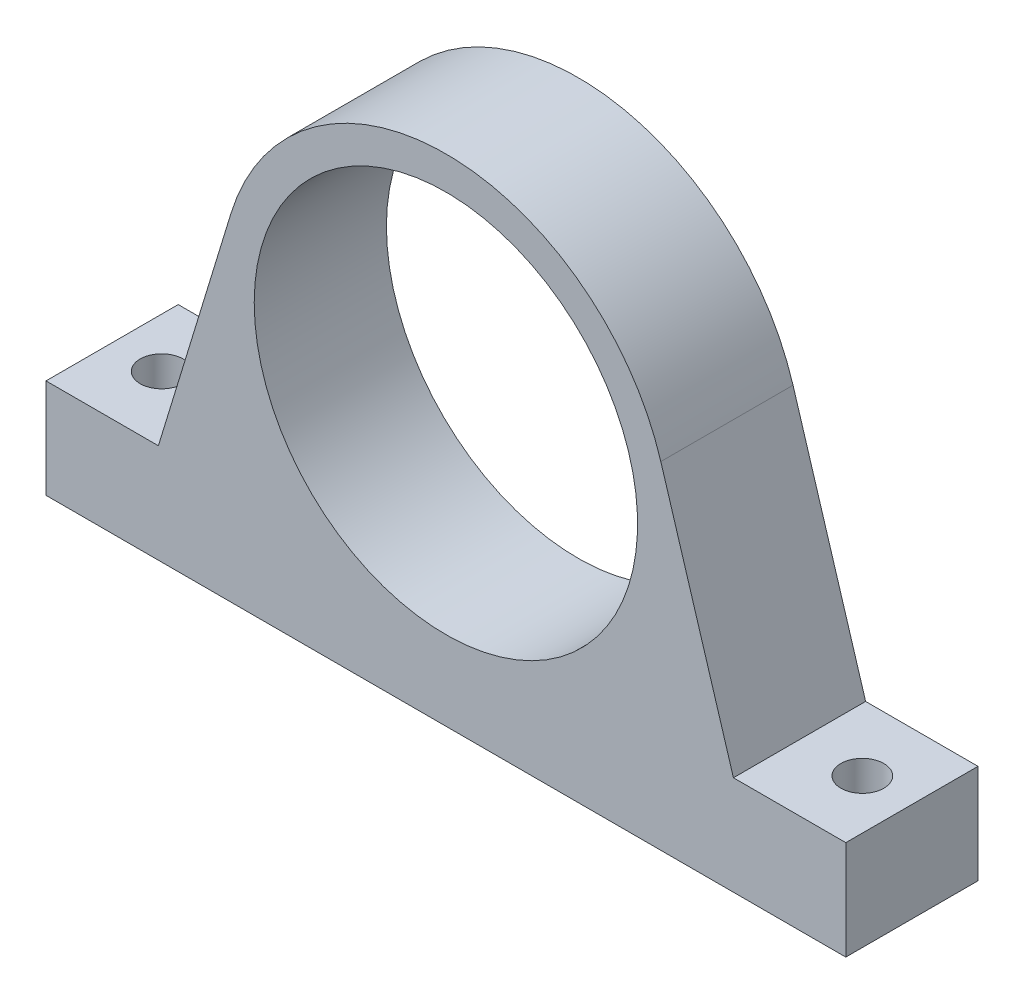
from build123d import *

# Parameters (mm, degrees)
BOSS_EXTRUDE1_DEPTH     = 20
CUT_EXTRUDE1_DEPTH      = 99.41366775
CUT_EXTRUDE1_DEPTH_BACK = 99.41366775
SKETCH2_R               = 29
SKETCH3_R               = 3.25
CUT_EXTRUDE2_DEPTH      = 88.522854158


with BuildPart() as part:
    # Sketch1 → Boss-Extrude1 (new body)
    with BuildSketch(Plane.XY):
        with BuildLine():
            Line((-60.5, 0), (60.5, 0))
            Line((60.5, 0), (60.5, 15))
            Line((60.5, 15), (43.5, 15))
            Line((43.5, 15), (32.514998433, 50.938555071))
            ThreePointArc((32.514998433, 50.938555071), (0, 75), (-32.514998433, 50.938555071))
            Line((-32.514998433, 50.938555071), (-43.5, 15))
            Line((-43.5, 15), (-60.5, 15))
            Line((-60.5, 15), (-60.5, 0))
        make_face()
    extrude(amount=BOSS_EXTRUDE1_DEPTH)

    # Sketch2 → Cut-Extrude1 (cut, two sides: drawn at the far end of the back side and taken through both)
    with BuildSketch(Plane(origin=(0, 0, 0), x_dir=(-1, 0, 0), z_dir=(0, 0, -1)).offset(-CUT_EXTRUDE1_DEPTH_BACK)):
        with Locations((0, 41)):
            Circle(SKETCH2_R)
    extrude(amount=CUT_EXTRUDE1_DEPTH + CUT_EXTRUDE1_DEPTH_BACK, mode=Mode.SUBTRACT)

    # Sketch3 → Cut-Extrude2 (cut, symmetric)
    with BuildSketch(Plane(origin=(0, 15, 0), x_dir=(1, 0, 0), z_dir=(0, 1, 0))):
        with Locations((-53, -10)):
            Circle(SKETCH3_R)
    cut_extrude2 = extrude(amount=CUT_EXTRUDE2_DEPTH, both=True, mode=Mode.SUBTRACT)

    # Mirror1: Cut-Extrude2 across plane
    add(cut_extrude2.mirror(Plane(origin=(0, 0, 0), x_dir=(0, 0, 1), z_dir=(1, 0, 0))), mode=Mode.SUBTRACT)


solid = part.part
